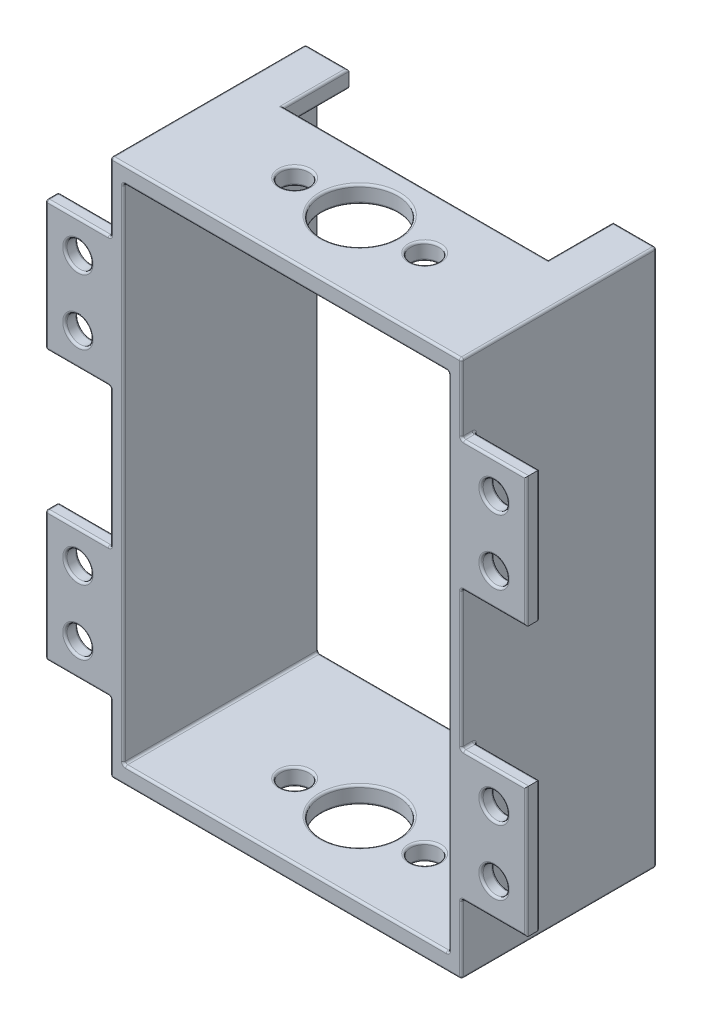
from build123d import *

# Parameters (mm, degrees)
SKETCH1_W           = 75
SKETCH1_H           = 45
SKETCH1_R           = 8.75
SKETCH1_R_2         = 3.25
BOSS_EXTRUDE1_DEPTH = 4
SKETCH2_W           = 45
SKETCH2_H           = 120
BOSS_EXTRUDE2_DEPTH = 3
SKETCH3_W           = 81
SKETCH3_H           = 45
SKETCH3_R           = 8.75
SKETCH3_R_2         = 3.25
BOSS_EXTRUDE3_DEPTH = 4
SKETCH5_W           = 15
SKETCH5_H           = 30
SKETCH5_R           = 3
BOSS_EXTRUDE5_DEPTH = 3
CUT_EXTRUDE1_REACH  = 163.4
SKETCH6_W           = 61
SKETCH6_H           = 15
FILLET1_R           = 0.5


with BuildPart() as part:
    # Sketch1 → Boss-Extrude1 (new body)
    with BuildSketch(Plane(origin=(0, 0, 0), x_dir=(1, 0, 0), z_dir=(0, 1, 0))):
        with Locations((37.5, 22.5)):
            Rectangle(SKETCH1_W, SKETCH1_H)
        with Locations((37.5, 17)):
            Circle(SKETCH1_R, mode=Mode.SUBTRACT)
        with Locations((22.5, 17)):
            Circle(SKETCH1_R_2, mode=Mode.SUBTRACT)
        with Locations((52.5, 17)):
            Circle(SKETCH1_R_2, mode=Mode.SUBTRACT)
    extrude(amount=BOSS_EXTRUDE1_DEPTH)

    # Sketch2 → Boss-Extrude2 (add)
    with BuildSketch(Plane.ZY):
        with Locations((-22.5, 60)):
            Rectangle(SKETCH2_W, SKETCH2_H)
    boss_extrude2 = extrude(amount=BOSS_EXTRUDE2_DEPTH)

    # Mirror1: Boss-Extrude2 across plane
    add(boss_extrude2.mirror(Plane(origin=(37.5, 0, 0), x_dir=(0, 0, 1), z_dir=(1, 0, 0))))

    # Sketch3 → Boss-Extrude3 (add)
    with BuildSketch(Plane(origin=(0, 120, 0), x_dir=(1, 0, 0), z_dir=(0, 1, 0))):
        with Locations((37.5, 22.5)):
            Rectangle(SKETCH3_W, SKETCH3_H)
        with Locations((37.5, 17)):
            Circle(SKETCH3_R, mode=Mode.SUBTRACT)
        with Locations((22.5, 17)):
            Circle(SKETCH3_R_2, mode=Mode.SUBTRACT)
        with Locations((52.5, 17)):
            Circle(SKETCH3_R_2, mode=Mode.SUBTRACT)
    extrude(amount=BOSS_EXTRUDE3_DEPTH)

    # Sketch5 → Boss-Extrude5 (add)
    # profile 1 of 2: a face of its own
    with BuildSketch(Plane.XY):
        with Locations((-10.5, 93)):
            Rectangle(SKETCH5_W, SKETCH5_H)
        with Locations((-10.5, 100.5)):
            Circle(SKETCH5_R, mode=Mode.SUBTRACT)
        with Locations((-10.5, 85.5)):
            Circle(SKETCH5_R, mode=Mode.SUBTRACT)
    # profile 2 of 2: a face of its own
    with BuildSketch(Plane.XY):
        with Locations((-10.5, 31)):
            Rectangle(SKETCH5_W, SKETCH5_H)
        with Locations((-10.5, 38.5)):
            Circle(SKETCH5_R, mode=Mode.SUBTRACT)
        with Locations((-10.5, 23.5)):
            Circle(SKETCH5_R, mode=Mode.SUBTRACT)
    boss_extrude5 = extrude(amount=-BOSS_EXTRUDE5_DEPTH)

    # Mirror2: Boss-Extrude5 across plane
    add(boss_extrude5.mirror(Plane(origin=(37.5, 0, 0), x_dir=(0, 0, 1), z_dir=(1, 0, 0))))

    # Sketch6 → Cut-Extrude1 (cut, up to next)
    with BuildSketch(Plane(origin=(0, 124, 0), x_dir=(1, 0, 0), z_dir=(0, 1, 0)), mode=Mode.PRIVATE) as cut_extrude1_sk1:
        with Locations((37.5, 37.5)):
            Rectangle(SKETCH6_W, SKETCH6_H)
    cut_extrude1_tool1 = extrude(cut_extrude1_sk1.sketch, amount=-CUT_EXTRUDE1_REACH, mode=Mode.PRIVATE) & part.part
    add(cut_extrude1_tool1.solids().sort_by_distance((37.5, 124, -37.5))[0], mode=Mode.SUBTRACT)

    # Fillet1
    fillet1_edges = [part.edges().sort_by_distance(p)[0] for p in [
        (71.5, 120, -45),
        (3.5, 120, -45),
        (37.5, 4, -45),
        (-3, 62, -45),
        (-3, 108, -1.5),
        (-3, 78, -1.5),
        (-3, 46, -1.5),
        (-3, 16, -1.5),
        (75, 62, -45),
        (75, 120, -22.5),
        (75, 4, -22.5),
        (0, 120, -22.5),
        (0, 62, -45),
        (0, 4, -22.5),
        (49.25, 124, -17),
        (19.25, 124, -17),
        (28.75, 124, -17),
        (-3, 124, -22.5),
        (2, 124, -45),
        (7, 124, -37.5),
        (37.5, 124, -30),
        (68, 124, -37.5),
        (73, 124, -45),
        (88.5, 23.5, 0),
        (88.5, 38.5, 0),
        (88.5, 85.5, 0),
        (88.5, 100.5, 0),
        (-13.5, 38.5, 0),
        (-13.5, 23.5, 0),
        (-13.5, 100.5, 0),
        (-13.5, 85.5, 0),
        (-3, 8, 0),
        (-10.5, 16, 0),
        (-10.5, 46, 0),
        (-3, 62, 0),
        (-10.5, 78, 0),
        (-10.5, 108, 0),
        (-3, 116, 0),
        (37.5, 124, 0),
        (85.5, 108, 0),
        (93, 93, 0),
        (85.5, 78, 0),
        (85.5, 46, 0),
        (93, 31, 0),
        (85.5, 16, 0),
        (37.5, 4, 0),
        (75, 62, 0),
        (37.5, 120, 0),
        (0, 62, 0),
        (88.5, 23.5, -3),
        (85.5, 16, -3),
        (93, 31, -3),
        (85.5, 46, -3),
        (88.5, 38.5, -3),
        (88.5, 85.5, -3),
        (88.5, 100.5, -3),
        (85.5, 78, -3),
        (93, 93, -3),
        (85.5, 108, -3),
        (78, 78, -1.5),
        (78, 93, -3),
        (78, 108, -1.5),
        (78, 116, 0),
        (78, 124, -22.5),
        (78, 62, -45),
        (78, 8, 0),
        (78, 16, -1.5),
        (78, 31, -3),
        (78, 46, -1.5),
        (78, 62, 0),
        (28.75, 0, -17),
        (19.25, 0, -17),
        (78, 0, -22.5),
        (37.5, 0, -45),
        (-3, 0, -22.5),
        (37.5, 0, 0),
        (49.25, 0, -17),
        (-10.5, 108, -3),
        (-10.5, 78, -3),
        (-3, 93, -3),
        (-13.5, 100.5, -3),
        (-13.5, 85.5, -3),
        (-10.5, 46, -3),
        (-10.5, 16, -3),
        (-3, 31, -3),
        (-13.5, 38.5, -3),
        (-13.5, 23.5, -3),
        (-18, 78, -1.5),
        (-18, 93, -3),
        (-18, 108, -1.5),
        (-18, 93, 0),
        (-18, 16, -1.5),
        (-18, 31, -3),
        (-18, 46, -1.5),
        (-18, 31, 0),
        (49.25, 120, -17),
        (28.75, 120, -17),
        (19.25, 120, -17),
        (37.5, 120, -30),
        (7, 120, -37.5),
        (68, 120, -37.5),
        (28.75, 4, -17),
        (49.25, 4, -17),
        (19.25, 4, -17),
    ]]
    fillet(fillet1_edges, radius=FILLET1_R)


solid = part.part
